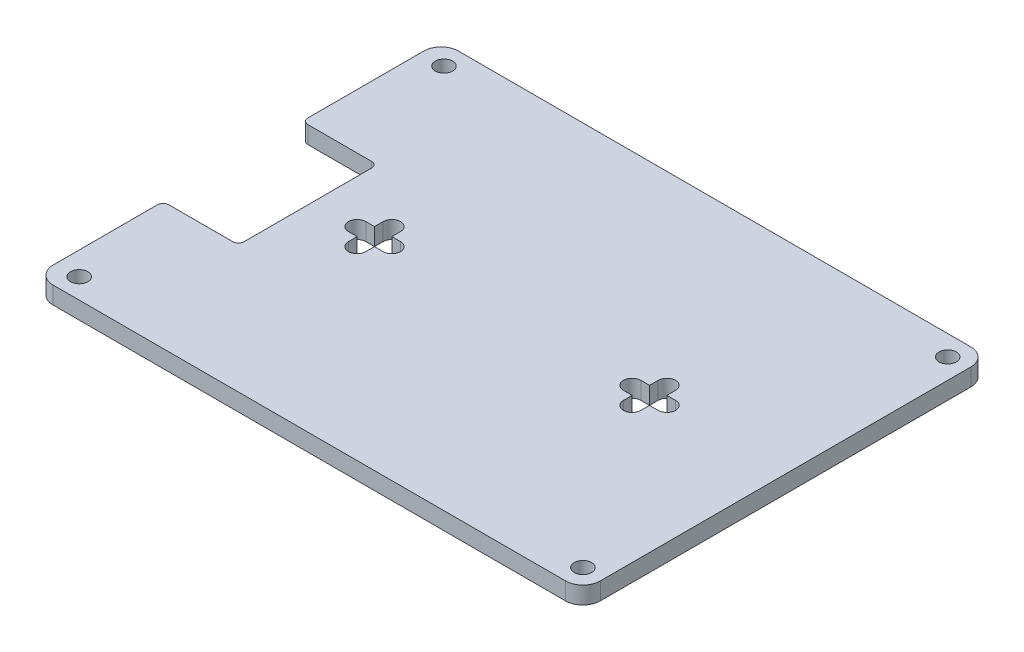
from build123d import *

# Parameters (mm, degrees)
SKETCH1_W           = 94.5
SKETCH1_H           = 70
BOSS_EXTRUDE1_DEPTH = 3
SKETCH3_R           = 1.5
CUT_EXTRUDE2_DEPTH  = 59.877521177
FILLET2_R           = 3
SKETCH5_W           = 13
SKETCH5_H           = 24
CUT_EXTRUDE3_DEPTH  = 59.877521177
FILLET3_R           = 1
FILLET5_R           = 1.5
FILLET6_R           = 1.5
FILLET7_R           = 1.5
FILLET8_R           = 1.5
FILLET9_R           = 1.5
FILLET10_R          = 1.5
FILLET11_R          = 1.5
FILLET12_R          = 1.5


with BuildPart() as part:
    # Sketch1 → Boss-Extrude1 (new body)
    with BuildSketch(Plane(origin=(0, 0, 0), x_dir=(1, 0, 0), z_dir=(0, 1, 0))):
        Rectangle(SKETCH1_W, SKETCH1_H)
    extrude(amount=BOSS_EXTRUDE1_DEPTH)

    # Sketch3 → Cut-Extrude2 (cut, through all)
    with BuildSketch(Plane(origin=(0, 3, 0), x_dir=(1, 0, 0), z_dir=(0, 1, 0))):
        with Locations(Location((43.75, 31.5, 0), (0, 0, 270))):
            Circle(SKETCH3_R)
        with Locations(Location((-43.25, 31.5, 0), (0, 0, 270))):
            Circle(SKETCH3_R)
        with Locations(Location((-43.25, -31.5, 0), (0, 0, 270))):
            Circle(SKETCH3_R)
        with Locations(Location((43.75, -31.5, 0), (0, 0, 270))):
            Circle(SKETCH3_R)
    extrude(amount=-CUT_EXTRUDE2_DEPTH, mode=Mode.SUBTRACT)

    # Fillet2
    fillet2_edges = [part.edges().sort_by_distance(p)[0] for p in [
        (47.25, 1.5, 35),
        (-47.25, 1.5, 35),
        (-47.25, 1.5, -35),
        (47.25, 1.5, -35),
    ]]
    fillet(fillet2_edges, radius=FILLET2_R)

    # Sketch5 → Cut-Extrude3 (cut, through all)
    with BuildSketch(Plane(origin=(0, 3, 0), x_dir=(1, 0, 0), z_dir=(0, 1, 0))):
        with Locations((-40.75, -1)):
            Rectangle(SKETCH5_W, SKETCH5_H)
        Polygon((-25.25, 1.5), (-25.25, 4.5), (-22.25, 4.5), (-22.25, 1.5), (-19.25, 1.5), (-19.25, -1.5), (-22.25, -1.5), (-22.25, -4.5), (-25.25, -4.5), (-25.25, -1.5), (-28.25, -1.5), (-28.25, 1.5), align=None)
        Polygon((25.25, 1.5), (25.25, 4.5), (22.25, 4.5), (22.25, 1.5), (19.25, 1.5), (19.25, -1.5), (22.25, -1.5), (22.25, -4.5), (25.25, -4.5), (25.25, -1.5), (28.25, -1.5), (28.25, 1.5), align=None)
    extrude(amount=-CUT_EXTRUDE3_DEPTH, mode=Mode.SUBTRACT)

    # Fillet3
    fillet3_edges = [part.edges().sort_by_distance(p)[0] for p in [
        (-34.25, 1.5, 13),
        (-47.25, 1.5, 13),
        (-47.25, 1.5, -11),
        (-34.25, 1.5, -11),
    ]]
    fillet(fillet3_edges, radius=FILLET3_R)

    # Fillet5
    fillet5_edges = [part.edges().sort_by_distance(p)[0] for p in [
        (-25.25, 1.5, -4.5),
        (-22.25, 1.5, -4.5),
    ]]
    fillet(fillet5_edges, radius=FILLET5_R - 0.0001)  # a hair under: the kernel refuses the full size

    # Fillet6
    fillet6_edges = [part.edges().sort_by_distance(p)[0] for p in [
        (-28.25, 1.5, 1.5),
        (-28.25, 1.5, -1.5),
    ]]
    fillet(fillet6_edges, radius=FILLET6_R - 0.0001)  # a hair under: the kernel refuses the full size

    # Fillet7
    fillet7_edges = [part.edges().sort_by_distance(p)[0] for p in [
        (-19.25, 1.5, -1.5),
        (-19.25, 1.5, 1.5),
    ]]
    fillet(fillet7_edges, radius=FILLET7_R - 0.0001)  # a hair under: the kernel refuses the full size

    # Fillet8
    fillet8_edges = [part.edges().sort_by_distance(p)[0] for p in [
        (-22.25, 1.5, 4.5),
        (-25.25, 1.5, 4.5),
    ]]
    fillet(fillet8_edges, radius=FILLET8_R - 0.0001)  # a hair under: the kernel refuses the full size

    # Fillet9
    fillet9_edges = [part.edges().sort_by_distance(p)[0] for p in [
        (25.25, 1.5, -4.5),
        (22.25, 1.5, -4.5),
    ]]
    fillet(fillet9_edges, radius=FILLET9_R - 0.0001)  # a hair under: the kernel refuses the full size

    # Fillet10
    fillet10_edges = [part.edges().sort_by_distance(p)[0] for p in [
        (28.25, 1.5, -1.5),
        (28.25, 1.5, 1.5),
    ]]
    fillet(fillet10_edges, radius=FILLET10_R - 0.0001)  # a hair under: the kernel refuses the full size

    # Fillet11
    fillet11_edges = [part.edges().sort_by_distance(p)[0] for p in [
        (25.25, 1.5, 4.5),
        (22.25, 1.5, 4.5),
    ]]
    fillet(fillet11_edges, radius=FILLET11_R - 0.0001)  # a hair under: the kernel refuses the full size

    # Fillet12
    fillet12_edges = [part.edges().sort_by_distance(p)[0] for p in [
        (19.25, 1.5, 1.5),
        (19.25, 1.5, -1.5),
    ]]
    fillet(fillet12_edges, radius=FILLET12_R - 0.0001)  # a hair under: the kernel refuses the full size


solid = part.part
